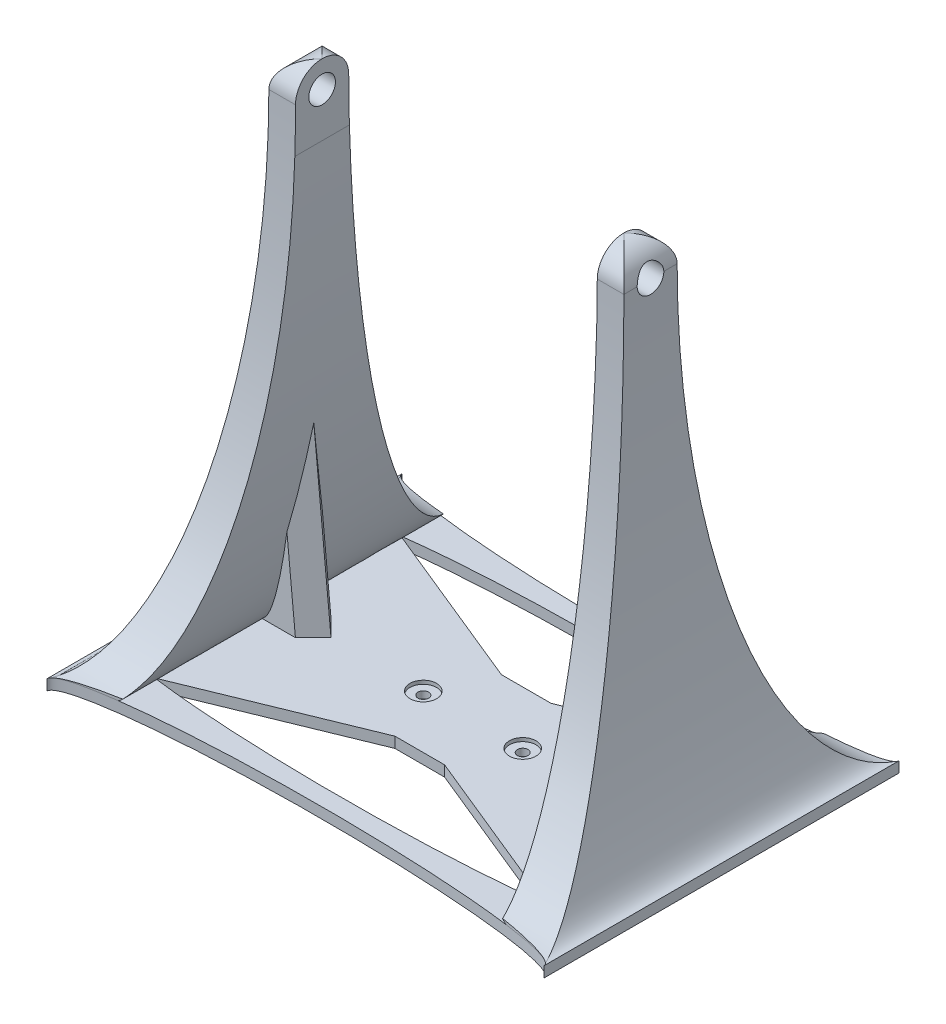
from build123d import *

# Parameters (mm, degrees)
SKETCH1_R                = 1.5
BOSS_EXTRUDE1_DEPTH      = 3
SKETCH2_R                = 3.75
CUT_EXTRUDE1_DEPTH       = 1
BOSS_EXTRUDE2_DEPTH      = 50
BOSS_EXTRUDE2_DEPTH_BACK = 50
CUT_EXTRUDE2_DEPTH       = 100
CUT_EXTRUDE2_DEPTH_BACK  = 100
SKETCH4_R                = 3.75
SKETCH5_RX               = 70
SKETCH5_RY               = 7.5
CUT_EXTRUDE3_DEPTH       = 50
BOSS_EXTRUDE3_DEPTH      = 5
BOSS_EXTRUDE3_DEPTH_BACK = 5
CHAMFER1_SIZE            = 5


with BuildPart() as part:
    # Sketch1 → Boss-Extrude1 (new body)
    with BuildSketch(Plane(origin=(0, 0, 0), x_dir=(1, 0, 0), z_dir=(0, 1, 0))):
        with BuildLine():
            Line((-70, 50), (-70, -50))
            add(Edge.make_bspline(
                [(70, -50), (70, -42.5), (0, -42.5), (-70, -42.5), (-70, -50)],
                knots=[0, 0, 0, 1.570796327, 1.570796327, 3.141592654, 3.141592654, 3.141592654], degree=2, weights=[1, 0.707106781, 1, 0.707106781, 1]))
            Line((70, -50), (70, 50))
            add(Edge.make_bspline(
                [(-70, 50), (-70, 42.5), (0, 42.5), (70, 42.5), (70, 50)],
                knots=[3.141592654, 3.141592654, 3.141592654, 4.71238898, 4.71238898, 6.283185307, 6.283185307, 6.283185307], degree=2, weights=[1, 0.707106781, 1, 0.707106781, 1]))
        make_face()
        with Locations(Location((-14, 0, 0), (0, 0, 270))):
            Circle(SKETCH1_R, mode=Mode.SUBTRACT)
        with Locations(Location((14, 0, 0), (0, 0, 270))):
            Circle(SKETCH1_R, mode=Mode.SUBTRACT)
        with BuildLine():
            Line((-7, 15), (-55, 34.639421806))
            add(Edge.make_bspline(
                [(55, 34.639421806), (0, 42.124355653), (-55, 34.639421806)],
                knots=[3.808538998, 3.808538998, 3.808538998, 5.616238963, 5.616238963, 5.616238963], degree=2, weights=[1, 0.618589574, 1]))
            Line((55, 34.639421806), (7, 15))
            Line((7, 15), (-7, 15))
        make_face(mode=Mode.SUBTRACT)
        with BuildLine():
            Line((7, -15), (55, -34.639421806))
            add(Edge.make_bspline(
                [(-55, -34.639421806), (0, -42.124355653), (55, -34.639421806)],
                knots=[0.666946345, 0.666946345, 0.666946345, 2.474646309, 2.474646309, 2.474646309], degree=2, weights=[1, 0.618589574, 1]))
            Line((-55, -34.639421806), (-7, -15))
            Line((-7, -15), (7, -15))
        make_face(mode=Mode.SUBTRACT)
    extrude(amount=BOSS_EXTRUDE1_DEPTH)

    # Sketch2 → Cut-Extrude1 (cut)
    with BuildSketch(Plane(origin=(0, 3, 0), x_dir=(1, 0, 0), z_dir=(0, 1, 0))):
        with Locations(Location((-14, 0, 0), (0, 0, 270))):
            Circle(SKETCH2_R)
        with Locations(Location((14, 0, 0), (0, 0, 270))):
            Circle(SKETCH2_R)
    extrude(amount=-CUT_EXTRUDE1_DEPTH, mode=Mode.SUBTRACT)

    # Sketch3 → Boss-Extrude2 (add, two sides: drawn at the far end of the back side and taken through both)
    with BuildSketch(Plane.XY.offset(-BOSS_EXTRUDE2_DEPTH_BACK)):
        with BuildLine():
            Line((-42.5, 143), (-42.5, 123))
            add(Edge.make_bspline(
                [(-55, 3), (-42.5, 3), (-42.5, 123)],
                knots=[3.141592654, 3.141592654, 3.141592654, 4.71238898, 4.71238898, 4.71238898], degree=2, weights=[1, 0.707106781, 1]))
            Line((-55, 3), (-70, 3))
            add(Edge.make_bspline(
                [(-70, 3), (-50, 3), (-50, 135.5)],
                knots=[3.141592654, 3.141592654, 3.141592654, 4.71238898, 4.71238898, 4.71238898], degree=2, weights=[1, 0.707106781, 1]))
            ThreePointArc((-50, 135.5), (-47.803300859, 140.803300859), (-42.5, 143))
        make_face()
        with BuildLine():
            Line((70, 3), (55, 3))
            add(Edge.make_bspline(
                [(42.5, 123), (42.5, 3), (55, 3)],
                knots=[1.570796327, 1.570796327, 1.570796327, 3.141592654, 3.141592654, 3.141592654], degree=2, weights=[1, 0.707106781, 1]))
            Line((42.5, 123), (42.5, 143))
            ThreePointArc((42.5, 143), (47.803300859, 140.803300859), (50, 135.5))
            add(Edge.make_bspline(
                [(50, 135.5), (50, 3), (70, 3)],
                knots=[1.570796327, 1.570796327, 1.570796327, 3.141592654, 3.141592654, 3.141592654], degree=2, weights=[1, 0.707106781, 1]))
        make_face()
    extrude(amount=BOSS_EXTRUDE2_DEPTH + BOSS_EXTRUDE2_DEPTH_BACK)

    # Sketch4 → Cut-Extrude2 (cut, two sides: drawn at the far end of the back side and taken through both)
    with BuildSketch(Plane(origin=(0, 0, 0), x_dir=(0, 0, -1), z_dir=(1, 0, 0)).offset(-CUT_EXTRUDE2_DEPTH_BACK)):
        with BuildLine():
            Line((-50, 143), (-50, 3))
            add(Edge.make_bspline(
                [(-50, 3), (-7.5, 3), (-7.5, 135.5)],
                knots=[3.141592654, 3.141592654, 3.141592654, 4.71238898, 4.71238898, 4.71238898], degree=2, weights=[1, 0.707106781, 1]))
            ThreePointArc((-7.5, 135.5), (-5.303300859, 140.803300859), (1e-09, 143))
            Line((1e-09, 143), (-50, 143))
        make_face()
        with BuildLine():
            Line((50, 143), (1e-09, 143))
            ThreePointArc((1e-09, 143), (5.303300859, 140.803300859), (7.5, 135.5))
            add(Edge.make_bspline(
                [(7.5, 135.5), (7.5, 3), (50, 3)],
                knots=[1.570796327, 1.570796327, 1.570796327, 3.141592654, 3.141592654, 3.141592654], degree=2, weights=[1, 0.707106781, 1]))
            Line((50, 3), (50, 143))
        make_face()
        with Locations(Location((0, 135.5, 0), (0, 0, 180))):
            Circle(SKETCH4_R)
    extrude(amount=CUT_EXTRUDE2_DEPTH + CUT_EXTRUDE2_DEPTH_BACK, mode=Mode.SUBTRACT)

    # Sketch5 → Cut-Extrude3 (cut)
    with BuildSketch(Plane.XZ):
        with Locations(Location((0, 50), (0, 0, -180))):
            Ellipse(SKETCH5_RX, SKETCH5_RY)
        with Locations(Location((0, -50), (0, 0, -180))):
            Ellipse(SKETCH5_RX, SKETCH5_RY)
    extrude(amount=-CUT_EXTRUDE3_DEPTH, mode=Mode.SUBTRACT)

    # Sketch7 → Boss-Extrude3 (add, two sides: drawn at the far end of the back side and taken through both)
    with BuildSketch(Plane.XY.offset(-BOSS_EXTRUDE3_DEPTH_BACK)):
        Polygon((-62.5, 3), (-44.847089224, 53), (-40, 3), align=None)
        Polygon((40, 3), (62.5, 3), (44.847089224, 53), align=None)
    extrude(amount=BOSS_EXTRUDE3_DEPTH + BOSS_EXTRUDE3_DEPTH_BACK)

    # Chamfer1
    chamfer1_edges = [part.edges().sort_by_distance(p)[0] for p in [
        (42.423544612, 28, -5),
        (42.423544612, 28, 5),
        (-42.423544612, 28, -5),
        (-42.423544612, 28, 5),
    ]]
    chamfer(chamfer1_edges, length=CHAMFER1_SIZE - 0.0001)  # a hair under: the kernel refuses the full size


solid = part.part
